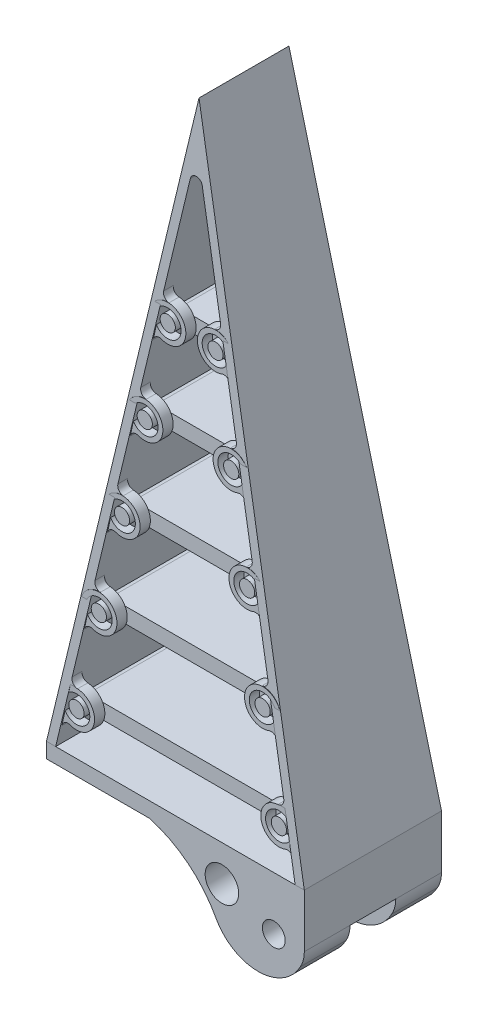
from build123d import *
from build123d.topology import SkipClean

# Parameters (mm, degrees)
AUFSATZ_LINEAR_AUSTRAGEN4_DEPTH      = 18
SCHNITT_LINEAR_AUSTRAGEN1_DEPTH      = 89.73537072
AUFSATZ_LINEAR_AUSTRAGEN5_DEPTH      = 5.37
AUFSATZ_LINEAR_AUSTRAGEN5_DEPTH_BACK = 5.37
AUFSATZ_LINEAR_AUSTRAGEN6_DEPTH      = 5.85
AUFSATZ_LINEAR_AUSTRAGEN6_DEPTH_BACK = 5.85
AUFSATZ_LINEAR_AUSTRAGEN7_DEPTH      = 6.3
AUFSATZ_LINEAR_AUSTRAGEN7_DEPTH_BACK = 6.3
AUFSATZ_LINEAR_AUSTRAGEN8_DEPTH      = 6.8
AUFSATZ_LINEAR_AUSTRAGEN8_DEPTH_BACK = 6.8
AUFSATZ_LINEAR_AUSTRAGEN9_DEPTH      = 7.2
AUFSATZ_LINEAR_AUSTRAGEN9_DEPTH_BACK = 7.2
SKIZZE13_R                           = 1
AUFSATZ_LINEAR_AUSTRAGEN12_DEPTH     = 1.5
SKIZZE15_R                           = 1
AUFSATZ_LINEAR_AUSTRAGEN14_DEPTH     = 1.5
SKIZZE14_R                           = 1
AUFSATZ_LINEAR_AUSTRAGEN13_DEPTH     = 1.5
SKIZZE16_R                           = 1
AUFSATZ_LINEAR_AUSTRAGEN15_DEPTH     = 1.5
SKIZZE17_R                           = 1
AUFSATZ_LINEAR_AUSTRAGEN16_DEPTH     = 1.5
SKIZZE18_R                           = 1
AUFSATZ_LINEAR_AUSTRAGEN17_DEPTH     = 1.5
SKIZZE19_R                           = 1
AUFSATZ_LINEAR_AUSTRAGEN18_DEPTH     = 1.5
SKIZZE20_R                           = 1
AUFSATZ_LINEAR_AUSTRAGEN19_DEPTH     = 1.5
SKIZZE21_R                           = 1
AUFSATZ_LINEAR_AUSTRAGEN20_DEPTH     = 1.5
SKIZZE22_R                           = 1
AUFSATZ_LINEAR_AUSTRAGEN21_DEPTH     = 1.5
SKIZZE24_R                           = 2.375
SKIZZE24_R_2                         = 1.75
AUFSATZ_LINEAR_AUSTRAGEN22_DEPTH     = 1.35
SKIZZE25_R                           = 2.375
SKIZZE25_R_2                         = 1.75
AUFSATZ_LINEAR_AUSTRAGEN23_DEPTH     = 1.35
SKIZZE26_R                           = 2.375
SKIZZE26_R_2                         = 1.75
AUFSATZ_LINEAR_AUSTRAGEN24_DEPTH     = 1.35
SKIZZE27_R                           = 2.375
SKIZZE27_R_2                         = 1.75
AUFSATZ_LINEAR_AUSTRAGEN25_DEPTH     = 1.35
SKIZZE28_R                           = 2.375
SKIZZE28_R_2                         = 1.75
AUFSATZ_LINEAR_AUSTRAGEN26_DEPTH     = 1.35
AUFSATZ_LINEAR_START                 = -1.35
SKIZZE29_R                           = 2.375
SKIZZE29_R_2                         = 1.75
AUFSATZ_LINEAR_AUSTRAGEN27_DEPTH     = 1.35
SKIZZE30_R                           = 2.375
SKIZZE30_R_2                         = 1.75
AUFSATZ_LINEAR_AUSTRAGEN28_DEPTH     = 1.35
SKIZZE31_R                           = 2.375
SKIZZE31_R_2                         = 1.75
AUFSATZ_LINEAR_AUSTRAGEN29_DEPTH     = 1.35
SKIZZE32_R                           = 2.375
SKIZZE32_R_2                         = 1.75
AUFSATZ_LINEAR_AUSTRAGEN30_DEPTH     = 1.35
SKIZZE33_R                           = 2.375
SKIZZE33_R_2                         = 1.75
AUFSATZ_LINEAR_AUSTRAGEN31_DEPTH     = 1.35
VERRUNDUNG1_R                        = 0.8
VERRUNDUNG2_R                        = 0.8
AUFSATZ_LINEAR_AUSTRAGEN32_DEPTH     = 2
SKIZZE38_R                           = 4
SKIZZE38_R_2                         = 1.5
AUFSATZ_LINEAR_AUSTRAGEN34_DEPTH     = 18
SCHNITT_LINEAR_START                 = -6
SKIZZE39_R                           = 4
SCHNITT_LINEAR_AUSTRAGEN2_DEPTH      = 6
SKIZZE40_W                           = 6
SKIZZE40_H                           = 11.711498973
SCHNITT_LINEAR_AUSTRAGEN3_DEPTH      = 33.6
SKIZZE41_R                           = 2.2
SCHNITT_LINEAR_AUSTRAGEN4_DEPTH      = 96.518560321
AUFSATZ_LINEAR_AUSTRAGEN35_DEPTH     = 25


with BuildPart() as part:
    # Skizze1 → Aufsatz-Linear austragen4 (new body)
    with BuildSketch(Plane.XY):
        Polygon((0, 0), (16.911148858, -80), (15.711148858, -80), (0, -5.676728459), (-15.711148858, -80), (-16.911148858, -80), align=None)
    extrude(amount=AUFSATZ_LINEAR_AUSTRAGEN4_DEPTH)

    # Skizze11 → Schnitt-Linear austragen1 (cut, through all)
    with BuildSketch(Plane(origin=(17, 0, 0), x_dir=(0, 0, -1), z_dir=(1, 0, 0))):
        Polygon((-18, -80), (-14.9, 0), (-18, 0), align=None)
        Polygon((0, -80), (-3.1, 0), (0, 0), align=None)
    extrude(amount=-SCHNITT_LINEAR_AUSTRAGEN1_DEPTH, mode=Mode.SUBTRACT)

    # Skizze24 → Aufsatz-Linear austragen22 (add)
    # profile 1 of 2: a face of its own
    with BuildSketch(Plane.XY.offset(15.87)):
        with Locations((-3.132547008, -26.676728459)):
            Circle(SKIZZE24_R)
        with Locations((-3.132547008, -26.676728459)):
            Circle(SKIZZE24_R_2, mode=Mode.SUBTRACT)
    # profile 2 of 2: a face of its own
    with BuildSketch(Plane.XY.offset(15.87)):
        with Locations((3.132547008, -26.676728459)):
            Circle(SKIZZE24_R)
        with Locations((3.132547008, -26.676728459)):
            Circle(SKIZZE24_R_2, mode=Mode.SUBTRACT)
    extrude(amount=-AUFSATZ_LINEAR_AUSTRAGEN22_DEPTH)

    # Skizze25 → Aufsatz-Linear austragen23 (add)
    # profile 1 of 2: a face of its own
    with BuildSketch(Plane.XY.offset(16.35)):
        with Locations((-5.669219336, -38.676728459)):
            Circle(SKIZZE25_R)
        with Locations((-5.669219336, -38.676728459)):
            Circle(SKIZZE25_R_2, mode=Mode.SUBTRACT)
    # profile 2 of 2: a face of its own
    with BuildSketch(Plane.XY.offset(16.35)):
        with Locations((5.669219336, -38.676728459)):
            Circle(SKIZZE25_R)
        with Locations((5.669219336, -38.676728459)):
            Circle(SKIZZE25_R_2, mode=Mode.SUBTRACT)
    extrude(amount=-AUFSATZ_LINEAR_AUSTRAGEN23_DEPTH)

    # Skizze26 → Aufsatz-Linear austragen24 (add)
    # profile 1 of 2: a face of its own
    with BuildSketch(Plane.XY.offset(16.8)):
        with Locations((-8.205891665, -50.676728459)):
            Circle(SKIZZE26_R)
        with Locations((-8.205891665, -50.676728459)):
            Circle(SKIZZE26_R_2, mode=Mode.SUBTRACT)
    # profile 2 of 2: a face of its own
    with BuildSketch(Plane.XY.offset(16.8)):
        with Locations((8.205891665, -50.676728459)):
            Circle(SKIZZE26_R)
        with Locations((8.205891665, -50.676728459)):
            Circle(SKIZZE26_R_2, mode=Mode.SUBTRACT)
    extrude(amount=-AUFSATZ_LINEAR_AUSTRAGEN24_DEPTH)

    # Skizze27 → Aufsatz-Linear austragen25 (add)
    # profile 1 of 2: a face of its own
    with BuildSketch(Plane.XY.offset(17.3)):
        with Locations((-10.742563994, -62.676728459)):
            Circle(SKIZZE27_R)
        with Locations((-10.742563994, -62.676728459)):
            Circle(SKIZZE27_R_2, mode=Mode.SUBTRACT)
    # profile 2 of 2: a face of its own
    with BuildSketch(Plane.XY.offset(17.3)):
        with Locations((10.742563994, -62.676728459)):
            Circle(SKIZZE27_R)
        with Locations((10.742563994, -62.676728459)):
            Circle(SKIZZE27_R_2, mode=Mode.SUBTRACT)
    extrude(amount=-AUFSATZ_LINEAR_AUSTRAGEN25_DEPTH)

    # Skizze28 → Aufsatz-Linear austragen26 (add)
    # profile 1 of 2: a face of its own
    with BuildSketch(Plane.XY.offset(17.7)):
        with Locations((-13.279236322, -74.676728459)):
            Circle(SKIZZE28_R)
        with Locations((-13.279236322, -74.676728459)):
            Circle(SKIZZE28_R_2, mode=Mode.SUBTRACT)
    # profile 2 of 2: a face of its own
    with BuildSketch(Plane.XY.offset(17.7)):
        with Locations((13.279236322, -74.676728459)):
            Circle(SKIZZE28_R)
        with Locations((13.279236322, -74.676728459)):
            Circle(SKIZZE28_R_2, mode=Mode.SUBTRACT)
    extrude(amount=-AUFSATZ_LINEAR_AUSTRAGEN26_DEPTH)

    # Skizze29 → Aufsatz-Linear austragen27 (add)
    # profile 1 of 2: a face of its own
    with BuildSketch(Plane(origin=(0, 0, 2.13), x_dir=(-1, 0, 0), z_dir=(0, 0, -1)).offset(AUFSATZ_LINEAR_START)):
        with Locations((-3.132547008, -26.676728459)):
            Circle(SKIZZE29_R)
        with Locations((-3.132547008, -26.676728459)):
            Circle(SKIZZE29_R_2, mode=Mode.SUBTRACT)
    # profile 2 of 2: a face of its own
    with BuildSketch(Plane(origin=(0, 0, 2.13), x_dir=(-1, 0, 0), z_dir=(0, 0, -1)).offset(AUFSATZ_LINEAR_START)):
        with Locations((3.132547008, -26.676728459)):
            Circle(SKIZZE29_R)
        with Locations((3.132547008, -26.676728459)):
            Circle(SKIZZE29_R_2, mode=Mode.SUBTRACT)
    extrude(amount=AUFSATZ_LINEAR_AUSTRAGEN27_DEPTH)

    # Skizze30 → Aufsatz-Linear austragen28 (add)
    # profile 1 of 2: a face of its own
    with BuildSketch(Plane(origin=(0, 0, 1.65), x_dir=(-1, 0, 0), z_dir=(0, 0, -1)).offset(AUFSATZ_LINEAR_START)):
        with Locations((-5.669219336, -38.676728459)):
            Circle(SKIZZE30_R)
        with Locations((-5.669219336, -38.676728459)):
            Circle(SKIZZE30_R_2, mode=Mode.SUBTRACT)
    # profile 2 of 2: a face of its own
    with BuildSketch(Plane(origin=(0, 0, 1.65), x_dir=(-1, 0, 0), z_dir=(0, 0, -1)).offset(AUFSATZ_LINEAR_START)):
        with Locations((5.669219336, -38.676728459)):
            Circle(SKIZZE30_R)
        with Locations((5.669219336, -38.676728459)):
            Circle(SKIZZE30_R_2, mode=Mode.SUBTRACT)
    extrude(amount=AUFSATZ_LINEAR_AUSTRAGEN28_DEPTH)

    # Skizze31 → Aufsatz-Linear austragen29 (add)
    # profile 1 of 2: a face of its own
    with BuildSketch(Plane(origin=(0, 0, 1.2), x_dir=(-1, 0, 0), z_dir=(0, 0, -1)).offset(AUFSATZ_LINEAR_START)):
        with Locations((-8.205891665, -50.676728459)):
            Circle(SKIZZE31_R)
        with Locations((-8.205891665, -50.676728459)):
            Circle(SKIZZE31_R_2, mode=Mode.SUBTRACT)
    # profile 2 of 2: a face of its own
    with BuildSketch(Plane(origin=(0, 0, 1.2), x_dir=(-1, 0, 0), z_dir=(0, 0, -1)).offset(AUFSATZ_LINEAR_START)):
        with Locations((8.205891665, -50.676728459)):
            Circle(SKIZZE31_R)
        with Locations((8.205891665, -50.676728459)):
            Circle(SKIZZE31_R_2, mode=Mode.SUBTRACT)
    extrude(amount=AUFSATZ_LINEAR_AUSTRAGEN29_DEPTH)

    # Skizze32 → Aufsatz-Linear austragen30 (add)
    # profile 1 of 2: a face of its own
    with BuildSketch(Plane(origin=(0, 0, 0.7), x_dir=(-1, 0, 0), z_dir=(0, 0, -1)).offset(AUFSATZ_LINEAR_START)):
        with Locations((-10.742563994, -62.676728459)):
            Circle(SKIZZE32_R)
        with Locations((-10.742563994, -62.676728459)):
            Circle(SKIZZE32_R_2, mode=Mode.SUBTRACT)
    # profile 2 of 2: a face of its own
    with BuildSketch(Plane(origin=(0, 0, 0.7), x_dir=(-1, 0, 0), z_dir=(0, 0, -1)).offset(AUFSATZ_LINEAR_START)):
        with Locations((10.742563994, -62.676728459)):
            Circle(SKIZZE32_R)
        with Locations((10.742563994, -62.676728459)):
            Circle(SKIZZE32_R_2, mode=Mode.SUBTRACT)
    extrude(amount=AUFSATZ_LINEAR_AUSTRAGEN30_DEPTH)

    # Skizze33 → Aufsatz-Linear austragen31 (add)
    # profile 1 of 2: a face of its own
    with BuildSketch(Plane(origin=(0, 0, 0.3), x_dir=(-1, 0, 0), z_dir=(0, 0, -1)).offset(AUFSATZ_LINEAR_START)):
        with Locations((-13.279236322, -74.676728459)):
            Circle(SKIZZE33_R)
        with Locations((-13.279236322, -74.676728459)):
            Circle(SKIZZE33_R_2, mode=Mode.SUBTRACT)
    # profile 2 of 2: a face of its own
    with BuildSketch(Plane(origin=(0, 0, 0.3), x_dir=(-1, 0, 0), z_dir=(0, 0, -1)).offset(AUFSATZ_LINEAR_START)):
        with Locations((13.279236322, -74.676728459)):
            Circle(SKIZZE33_R)
        with Locations((13.279236322, -74.676728459)):
            Circle(SKIZZE33_R_2, mode=Mode.SUBTRACT)
    extrude(amount=AUFSATZ_LINEAR_AUSTRAGEN31_DEPTH)

    # Verrundung1
    verrundung1_edges = [part.edges().sort_by_distance(p)[0] for p in [
        (0, -5.676728459, 9),
    ]]
    fillet(verrundung1_edges, radius=VERRUNDUNG1_R)

    # Verrundung2
    # the kernel refuses this fillet: 0.8 mm, written as the material it adds along each edge
    with BuildSketch(Plane(origin=(7.333926251, -40.370651683, 15), x_dir=(0.20681895998091462, -0.9783792300495819, 0), z_dir=(0, 0, 1)), Plane(origin=(9.87059858, -52.370651683, 15.45), x_dir=(0.20681895998091263, -0.9783792300495825, 0), z_dir=(0, 0, 1)), Plane(origin=(12.407270908, -64.370651683, 15.95), x_dir=(0.20681895998091412, -0.9783792300495822, 0), z_dir=(0, 0, 1)), Plane(origin=(14.943943237, -76.370651683, 16.35), x_dir=(0.20681895998090907, -0.9783792300495833, 0), z_dir=(0, 0, 1)), Plane(origin=(4.797253922, -28.370651683, 2.13), x_dir=(0.20681895998091462, -0.9783792300495819, 0), z_dir=(0, 0, 1)), Plane(origin=(7.333926251, -40.370651683, 1.65), x_dir=(0.20681895998091462, -0.9783792300495819, 0), z_dir=(0, 0, 1)), Plane(origin=(9.87059858, -52.370651683, 1.2), x_dir=(0.20681895998091412, -0.9783792300495822, 0), z_dir=(0, 0, 1)), Plane(origin=(12.407270908, -64.370651683, 0.7), x_dir=(0.20681895998091412, -0.9783792300495822, 0), z_dir=(0, 0, 1)), Plane(origin=(14.943943237, -76.370651683, 0.3), x_dir=(0.20681895998091113, -0.9783792300495827, 0), z_dir=(0, 0, 1)), Plane(origin=(4.797253922, -28.370651683, 14.52), x_dir=(0.20681895998091462, -0.9783792300495819, 0), z_dir=(0, 0, 1))) as verrundung2_piece_1:
        with BuildLine():
            CenterArc((1.137162009, -0.8), VERRUNDUNG2_R, 90, 98.665792169)
            ThreePointArc((0.346294794, -0.920536499), (0.221320117, -0.44214625), (0, 0))
            Line((0, 0), (1.137162009, 0))
        make_face()
    extrude(amount=1.35)
    with BuildSketch(Plane(origin=(6.505991795, -36.45401911, 15), x_dir=(-0.20681895998091487, 0.9783792300495819, 0), z_dir=(0, 0, 1))) as verrundung2_piece_2_section:
        with BuildLine():
            CenterArc((1.137162009, 0.8), VERRUNDUNG2_R, 171.334207831, 98.665792169)
            ThreePointArc((0.346294794, 0.920536499), (0.221320117, 0.44214625), (0, 0))
            Line((0, 0), (1.137162009, 0))
        make_face()
    verrundung2_piece_2 = extrude(amount=4.155498263, mode=Mode.PRIVATE)
    verrundung2_piece_2 = split(verrundung2_piece_2, bisect_by=Plane(origin=(6.217215771, -36.095589606, 16.298704097), z_dir=(0, -0.03872093994908253, -0.9992500632021294)), keep=Keep.TOP, mode=Mode.PRIVATE)
    add(verrundung2_piece_2)
    with BuildSketch(Plane(origin=(-9.87059858, -52.370651683, 15.45), x_dir=(-0.20681895998091412, -0.9783792300495822, 0), z_dir=(0, 0, 1)), Plane(origin=(-12.407270908, -64.370651683, 15.95), x_dir=(-0.2068189599809156, -0.9783792300495817, 0), z_dir=(0, 0, 1)), Plane(origin=(-14.943943237, -76.370651683, 16.35), x_dir=(-0.2068189599809131, -0.9783792300495824, 0), z_dir=(0, 0, 1)), Plane(origin=(-4.797253922, -28.370651683, 2.13), x_dir=(-0.20681895998091113, -0.9783792300495827, 0), z_dir=(0, 0, 1)), Plane(origin=(-7.333926251, -40.370651683, 1.65), x_dir=(-0.2068189599809139, -0.9783792300495822, 0), z_dir=(0, 0, 1)), Plane(origin=(-9.87059858, -52.370651683, 1.2), x_dir=(-0.20681895998091412, -0.9783792300495822, 0), z_dir=(0, 0, 1)), Plane(origin=(-12.407270908, -64.370651683, 0.7), x_dir=(-0.20681895998091412, -0.9783792300495822, 0), z_dir=(0, 0, 1)), Plane(origin=(-14.943943237, -76.370651683, 0.3), x_dir=(-0.2068189599809131, -0.9783792300495824, 0), z_dir=(0, 0, 1)), Plane(origin=(-4.797253922, -28.370651683, 14.52), x_dir=(-0.20681895998091177, -0.9783792300495826, 0), z_dir=(0, 0, 1)), Plane(origin=(-7.333926251, -40.370651683, 15), x_dir=(-0.20681895998091412, -0.9783792300495822, 0), z_dir=(0, 0, 1))) as verrundung2_piece_3:
        with BuildLine():
            CenterArc((1.137162009, 0.8), VERRUNDUNG2_R, 171.334207831, 98.665792169)
            ThreePointArc((0.346294794, 0.920536499), (0.221320117, 0.44214625), (0, 0))
            Line((0, 0), (1.137162009, 0))
        make_face()
    extrude(amount=1.35)
    with BuildSketch(Plane(origin=(-9.042664124, -48.45401911, 15.45), x_dir=(0.20681895998091288, 0.9783792300495825, 0), z_dir=(0, 0, 1))) as verrundung2_piece_4_section:
        with BuildLine():
            CenterArc((1.137162009, -0.8), VERRUNDUNG2_R, 90, 98.665792169)
            ThreePointArc((0.346294794, -0.920536499), (0.221320117, -0.44214625), (0, 0))
            Line((0, 0), (1.137162009, 0))
        make_face()
    verrundung2_piece_4 = extrude(amount=4.170498263, mode=Mode.PRIVATE)
    verrundung2_piece_4 = split(verrundung2_piece_4, bisect_by=Plane(origin=(-8.753891259, -48.095283689, 16.763692243), z_dir=(0, -0.03872093994908253, -0.9992500632021294)), keep=Keep.TOP, mode=Mode.PRIVATE)
    add(verrundung2_piece_4)
    with BuildSketch(Plane(origin=(9.042664124, -48.45401911, 15.45), x_dir=(-0.2068189599809156, 0.9783792300495817, 0), z_dir=(0, 0, 1))) as verrundung2_piece_5_section:
        with BuildLine():
            CenterArc((1.137162009, 0.8), VERRUNDUNG2_R, 171.334207831, 98.665792169)
            ThreePointArc((0.346294794, 0.920536499), (0.221320117, 0.44214625), (0, 0))
            Line((0, 0), (1.137162009, 0))
        make_face()
    verrundung2_piece_5 = extrude(amount=4.170498263, mode=Mode.PRIVATE)
    verrundung2_piece_5 = split(verrundung2_piece_5, bisect_by=Plane(origin=(8.753891259, -48.095283689, 16.763692243), z_dir=(0, -0.03872093994908253, -0.9992500632021294)), keep=Keep.TOP, mode=Mode.PRIVATE)
    add(verrundung2_piece_5)
    with BuildSketch(Plane(origin=(-11.579336453, -60.45401911, 15.95), x_dir=(0.2068189599809101, 0.9783792300495829, 0), z_dir=(0, 0, 1))) as verrundung2_piece_6_section:
        with BuildLine():
            CenterArc((1.137162009, -0.8), VERRUNDUNG2_R, 90, 98.665792169)
            ThreePointArc((0.346294794, -0.920536499), (0.221320117, -0.44214625), (0, 0))
            Line((0, 0), (1.137162009, 0))
        make_face()
    verrundung2_piece_6 = extrude(amount=4.135498263, mode=Mode.PRIVATE)
    verrundung2_piece_6 = split(verrundung2_piece_6, bisect_by=Plane(origin=(-11.290556099, -60.095998069, 17.228719925), z_dir=(0, -0.03872093994908253, -0.9992500632021294)), keep=Keep.TOP, mode=Mode.PRIVATE)
    add(verrundung2_piece_6)
    with BuildSketch(Plane(origin=(11.579336453, -60.45401911, 15.95), x_dir=(-0.20681895998091435, 0.978379230049582, 0), z_dir=(0, 0, 1))) as verrundung2_piece_7_section:
        with BuildLine():
            CenterArc((1.137162009, 0.8), VERRUNDUNG2_R, 171.334207831, 98.665792169)
            ThreePointArc((0.346294794, 0.920536499), (0.221320117, 0.44214625), (0, 0))
            Line((0, 0), (1.137162009, 0))
        make_face()
    verrundung2_piece_7 = extrude(amount=4.135498263, mode=Mode.PRIVATE)
    verrundung2_piece_7 = split(verrundung2_piece_7, bisect_by=Plane(origin=(11.290556099, -60.095998069, 17.228719925), z_dir=(0, -0.03872093994908253, -0.9992500632021294)), keep=Keep.TOP, mode=Mode.PRIVATE)
    add(verrundung2_piece_7)
    with BuildSketch(Plane(origin=(-14.116008781, -72.45401911, 16.35), x_dir=(0.20681895998091412, 0.9783792300495822, 0), z_dir=(0, 0, 1))) as verrundung2_piece_8_section:
        with BuildLine():
            CenterArc((1.137162009, -0.8), VERRUNDUNG2_R, 90, 98.665792169)
            ThreePointArc((0.346294794, -0.920536499), (0.221320117, -0.44214625), (0, 0))
            Line((0, 0), (1.137162009, 0))
        make_face()
    verrundung2_piece_8 = extrude(amount=1.35, mode=Mode.PRIVATE)
    verrundung2_piece_8 = split(verrundung2_piece_8, bisect_by=Plane(origin=(-13.827218085, -72.094512866, 17.693662374), z_dir=(0, -0.03872093994908253, -0.9992500632021294)), keep=Keep.TOP, mode=Mode.PRIVATE)
    add(verrundung2_piece_8)
    with BuildSketch(Plane(origin=(14.116008781, -72.45401911, 16.35), x_dir=(-0.20681895998091662, 0.9783792300495815, 0), z_dir=(0, 0, 1))) as verrundung2_piece_9_section:
        with BuildLine():
            CenterArc((1.137162009, 0.8), VERRUNDUNG2_R, 171.334207831, 98.665792169)
            ThreePointArc((0.346294794, 0.920536499), (0.221320117, 0.44214625), (0, 0))
            Line((0, 0), (1.137162009, 0))
        make_face()
    verrundung2_piece_9 = extrude(amount=1.35, mode=Mode.PRIVATE)
    verrundung2_piece_9 = split(verrundung2_piece_9, bisect_by=Plane(origin=(13.827218085, -72.094512866, 17.693662374), z_dir=(0, -0.03872093994908253, -0.9992500632021294)), keep=Keep.TOP, mode=Mode.PRIVATE)
    add(verrundung2_piece_9)
    with BuildSketch(Plane(origin=(3.969319467, -24.45401911, -0.690498263), x_dir=(-0.20681895998091412, 0.9783792300495822, 0), z_dir=(0, 0, 1))) as verrundung2_piece_10_section:
        with BuildLine():
            CenterArc((1.137162009, 0.8), VERRUNDUNG2_R, 171.334207831, 98.665792169)
            ThreePointArc((0.346294794, 0.920536499), (0.221320117, 0.44214625), (0, 0))
            Line((0, 0), (1.137162009, 0))
        make_face()
    verrundung2_piece_10 = extrude(amount=4.170498263, mode=Mode.PRIVATE)
    verrundung2_piece_10 = split(verrundung2_piece_10, bisect_by=Plane(origin=(3.680546602, -24.095283689, 2.166307757), z_dir=(0, -0.03872093994908251, 0.9992500632021294)), keep=Keep.TOP, mode=Mode.PRIVATE)
    add(verrundung2_piece_10)
    with BuildSketch(Plane(origin=(-3.969319467, -24.45401911, -0.690498263), x_dir=(0.20681895998091285, 0.9783792300495823, 0), z_dir=(0, 0, 1))) as verrundung2_piece_11_section:
        with BuildLine():
            CenterArc((1.137162009, -0.8), VERRUNDUNG2_R, 90, 98.665792169)
            ThreePointArc((0.346294794, -0.920536499), (0.221320117, -0.44214625), (0, 0))
            Line((0, 0), (1.137162009, 0))
        make_face()
    verrundung2_piece_11 = extrude(amount=4.170498263, mode=Mode.PRIVATE)
    verrundung2_piece_11 = split(verrundung2_piece_11, bisect_by=Plane(origin=(-3.680546602, -24.095283689, 2.166307757), z_dir=(0, -0.03872093994908251, 0.9992500632021294)), keep=Keep.TOP, mode=Mode.PRIVATE)
    add(verrundung2_piece_11)
    with BuildSketch(Plane(origin=(6.505991795, -36.45401911, -1.155498263), x_dir=(-0.20681895998091537, 0.9783792300495818, 0), z_dir=(0, 0, 1))) as verrundung2_piece_12_section:
        with BuildLine():
            CenterArc((1.137162009, 0.8), VERRUNDUNG2_R, 171.334207831, 98.665792169)
            ThreePointArc((0.346294794, 0.920536499), (0.221320117, 0.44214625), (0, 0))
            Line((0, 0), (1.137162009, 0))
        make_face()
    verrundung2_piece_12 = extrude(amount=4.155498263, mode=Mode.PRIVATE)
    verrundung2_piece_12 = split(verrundung2_piece_12, bisect_by=Plane(origin=(6.217215771, -36.095589606, 1.701295903), z_dir=(0, -0.03872093994908251, 0.9992500632021294)), keep=Keep.TOP, mode=Mode.PRIVATE)
    add(verrundung2_piece_12)
    with BuildSketch(Plane(origin=(-6.505991795, -36.45401911, -1.155498263), x_dir=(0.20681895998091288, 0.9783792300495825, 0), z_dir=(0, 0, 1))) as verrundung2_piece_13_section:
        with BuildLine():
            CenterArc((1.137162009, -0.8), VERRUNDUNG2_R, 90, 98.665792169)
            ThreePointArc((0.346294794, -0.920536499), (0.221320117, -0.44214625), (0, 0))
            Line((0, 0), (1.137162009, 0))
        make_face()
    verrundung2_piece_13 = extrude(amount=4.155498263, mode=Mode.PRIVATE)
    verrundung2_piece_13 = split(verrundung2_piece_13, bisect_by=Plane(origin=(-6.217215771, -36.095589606, 1.701295903), z_dir=(0, -0.03872093994908251, 0.9992500632021294)), keep=Keep.TOP, mode=Mode.PRIVATE)
    add(verrundung2_piece_13)
    with BuildSketch(Plane(origin=(9.042664124, -48.45401911, -1.620498263), x_dir=(-0.20681895998091412, 0.9783792300495822, 0), z_dir=(0, 0, 1))) as verrundung2_piece_14_section:
        with BuildLine():
            CenterArc((1.137162009, 0.8), VERRUNDUNG2_R, 171.334207831, 98.665792169)
            ThreePointArc((0.346294794, 0.920536499), (0.221320117, 0.44214625), (0, 0))
            Line((0, 0), (1.137162009, 0))
        make_face()
    verrundung2_piece_14 = extrude(amount=4.170498263, mode=Mode.PRIVATE)
    verrundung2_piece_14 = split(verrundung2_piece_14, bisect_by=Plane(origin=(8.753891259, -48.095283689, 1.236307757), z_dir=(0, -0.03872093994908251, 0.9992500632021294)), keep=Keep.TOP, mode=Mode.PRIVATE)
    add(verrundung2_piece_14)
    with BuildSketch(Plane(origin=(-9.042664124, -48.45401911, -1.620498263), x_dir=(0.20681895998091263, 0.9783792300495825, 0), z_dir=(0, 0, 1))) as verrundung2_piece_15_section:
        with BuildLine():
            CenterArc((1.137162009, -0.8), VERRUNDUNG2_R, 90, 98.665792169)
            ThreePointArc((0.346294794, -0.920536499), (0.221320117, -0.44214625), (0, 0))
            Line((0, 0), (1.137162009, 0))
        make_face()
    verrundung2_piece_15 = extrude(amount=4.170498263, mode=Mode.PRIVATE)
    verrundung2_piece_15 = split(verrundung2_piece_15, bisect_by=Plane(origin=(-8.753891259, -48.095283689, 1.236307757), z_dir=(0, -0.03872093994908251, 0.9992500632021294)), keep=Keep.TOP, mode=Mode.PRIVATE)
    add(verrundung2_piece_15)
    with BuildSketch(Plane(origin=(11.579336453, -60.45401911, -2.085498263), x_dir=(-0.20681895998091412, 0.9783792300495822, 0), z_dir=(0, 0, 1))) as verrundung2_piece_16_section:
        with BuildLine():
            CenterArc((1.137162009, 0.8), VERRUNDUNG2_R, 171.334207831, 98.665792169)
            ThreePointArc((0.346294794, 0.920536499), (0.221320117, 0.44214625), (0, 0))
            Line((0, 0), (1.137162009, 0))
        make_face()
    verrundung2_piece_16 = extrude(amount=4.135498263, mode=Mode.PRIVATE)
    verrundung2_piece_16 = split(verrundung2_piece_16, bisect_by=Plane(origin=(11.290556099, -60.095998069, 0.771280075), z_dir=(0, -0.03872093994908251, 0.9992500632021294)), keep=Keep.TOP, mode=Mode.PRIVATE)
    add(verrundung2_piece_16)
    with BuildSketch(Plane(origin=(-11.579336453, -60.45401911, -2.085498263), x_dir=(0.2068189599809131, 0.9783792300495824, 0), z_dir=(0, 0, 1))) as verrundung2_piece_17_section:
        with BuildLine():
            CenterArc((1.137162009, -0.8), VERRUNDUNG2_R, 90, 98.665792169)
            ThreePointArc((0.346294794, -0.920536499), (0.221320117, -0.44214625), (0, 0))
            Line((0, 0), (1.137162009, 0))
        make_face()
    verrundung2_piece_17 = extrude(amount=4.135498263, mode=Mode.PRIVATE)
    verrundung2_piece_17 = split(verrundung2_piece_17, bisect_by=Plane(origin=(-11.290556099, -60.095998069, 0.771280075), z_dir=(0, -0.03872093994908251, 0.9992500632021294)), keep=Keep.TOP, mode=Mode.PRIVATE)
    add(verrundung2_piece_17)
    with BuildSketch(Plane(origin=(14.116008781, -72.45401911, 0.3), x_dir=(-0.2068189599809156, 0.9783792300495817, 0), z_dir=(0, 0, 1))) as verrundung2_piece_18_section:
        with BuildLine():
            CenterArc((1.137162009, 0.8), VERRUNDUNG2_R, 171.334207831, 98.665792169)
            ThreePointArc((0.346294794, 0.920536499), (0.221320117, 0.44214625), (0, 0))
            Line((0, 0), (1.137162009, 0))
        make_face()
    verrundung2_piece_18 = extrude(amount=1.35, mode=Mode.PRIVATE)
    verrundung2_piece_18 = split(verrundung2_piece_18, bisect_by=Plane(origin=(13.827218085, -72.094512866, 0.306337626), z_dir=(0, -0.03872093994908251, 0.9992500632021294)), keep=Keep.TOP, mode=Mode.PRIVATE)
    add(verrundung2_piece_18)
    with BuildSketch(Plane(origin=(-14.116008781, -72.45401911, 0.3), x_dir=(0.20681895998091412, 0.9783792300495822, 0), z_dir=(0, 0, 1))) as verrundung2_piece_19_section:
        with BuildLine():
            CenterArc((1.137162009, -0.8), VERRUNDUNG2_R, 90, 98.665792169)
            ThreePointArc((0.346294794, -0.920536499), (0.221320117, -0.44214625), (0, 0))
            Line((0, 0), (1.137162009, 0))
        make_face()
    verrundung2_piece_19 = extrude(amount=1.35, mode=Mode.PRIVATE)
    verrundung2_piece_19 = split(verrundung2_piece_19, bisect_by=Plane(origin=(-13.827218085, -72.094512866, 0.306337626), z_dir=(0, -0.03872093994908251, 0.9992500632021294)), keep=Keep.TOP, mode=Mode.PRIVATE)
    add(verrundung2_piece_19)
    with BuildSketch(Plane(origin=(-3.969319467, -24.45401911, 14.52), x_dir=(0.20681895998091399, 0.978379230049582, 0), z_dir=(0, 0, 1))) as verrundung2_piece_20_section:
        with BuildLine():
            CenterArc((1.137162009, -0.8), VERRUNDUNG2_R, 90, 98.665792169)
            ThreePointArc((0.346294794, -0.920536499), (0.221320117, -0.44214625), (0, 0))
            Line((0, 0), (1.137162009, 0))
        make_face()
    verrundung2_piece_20 = extrude(amount=4.170498263, mode=Mode.PRIVATE)
    verrundung2_piece_20 = split(verrundung2_piece_20, bisect_by=Plane(origin=(-3.680546602, -24.095283689, 15.833692243), z_dir=(0, -0.03872093994908253, -0.9992500632021294)), keep=Keep.TOP, mode=Mode.PRIVATE)
    add(verrundung2_piece_20)
    with BuildSketch(Plane(origin=(3.969319467, -24.45401911, 14.52), x_dir=(-0.20681895998091487, 0.9783792300495819, 0), z_dir=(0, 0, 1))) as verrundung2_piece_21_section:
        with BuildLine():
            CenterArc((1.137162009, 0.8), VERRUNDUNG2_R, 171.334207831, 98.665792169)
            ThreePointArc((0.346294794, 0.920536499), (0.221320117, 0.44214625), (0, 0))
            Line((0, 0), (1.137162009, 0))
        make_face()
    verrundung2_piece_21 = extrude(amount=4.170498263, mode=Mode.PRIVATE)
    verrundung2_piece_21 = split(verrundung2_piece_21, bisect_by=Plane(origin=(3.680546602, -24.095283689, 15.833692243), z_dir=(0, -0.03872093994908253, -0.9992500632021294)), keep=Keep.TOP, mode=Mode.PRIVATE)
    add(verrundung2_piece_21)
    with BuildSketch(Plane(origin=(-6.505991795, -36.45401911, 15), x_dir=(0.20681895998091263, 0.9783792300495825, 0), z_dir=(0, 0, 1))) as verrundung2_piece_22_section:
        with BuildLine():
            CenterArc((1.137162009, -0.8), VERRUNDUNG2_R, 90, 98.665792169)
            ThreePointArc((0.346294794, -0.920536499), (0.221320117, -0.44214625), (0, 0))
            Line((0, 0), (1.137162009, 0))
        make_face()
    verrundung2_piece_22 = extrude(amount=4.155498263, mode=Mode.PRIVATE)
    verrundung2_piece_22 = split(verrundung2_piece_22, bisect_by=Plane(origin=(-6.217215771, -36.095589606, 16.298704097), z_dir=(0, -0.03872093994908253, -0.9992500632021294)), keep=Keep.TOP, mode=Mode.PRIVATE)
    add(verrundung2_piece_22)

    # Skizze37 → Aufsatz-Linear austragen32 (add)
    with BuildSketch(Plane.XZ.offset(80)):
        Polygon((-16.911148858, 0), (-15.711148858, 0), (16.911148858, 0), (16.911148858, 18), (-16.911148858, 18), align=None)
    extrude(amount=AUFSATZ_LINEAR_AUSTRAGEN32_DEPTH)

    # Skizze38 → Aufsatz-Linear austragen34 (add)
    # profile 1 of 2: a face of its own
    with BuildSketch(Plane.XY.offset(18)):
        with BuildLine():
            Line((16.911148858, -87), (16.911148858, -82))
            Line((16.911148858, -82), (6.731290959, -82))
            Line((6.731290959, -82), (-3.39492553, -82))
            ThreePointArc((-3.39492553, -82), (1.666778025, -84.598508213), (5.313446098, -88.965990299))
            ThreePointArc((5.313446098, -88.965990299), (10.854055364, -92.270300803), (16.394664631, -88.965990299))
            ThreePointArc((16.394664631, -88.965990299), (9.042424062, -85.983649444), (16.911148858, -87))
        make_face()
    # profile 2 of 2: a face of its own
    with BuildSketch(Plane.XY.offset(18)):
        with Locations((12.911148858, -87)):
            Circle(SKIZZE38_R)
        with Locations((12.911148858, -87)):
            Circle(SKIZZE38_R_2, mode=Mode.SUBTRACT)
    extrude(amount=-AUFSATZ_LINEAR_AUSTRAGEN34_DEPTH)

    # Skizze39 → Schnitt-Linear austragen2 (cut)
    with BuildSketch(Plane.XY.offset(18).offset(SCHNITT_LINEAR_START)):
        with Locations((12.911148858, -87)):
            Circle(SKIZZE39_R)
    extrude(amount=-SCHNITT_LINEAR_AUSTRAGEN2_DEPTH, mode=Mode.SUBTRACT)

    # Skizze40 → Schnitt-Linear austragen3 (cut)
    with BuildSketch(Plane.ZY.offset(16.911148858)):
        with Locations((9, -87.855749487)):
            Rectangle(SKIZZE40_W, SKIZZE40_H)
    extrude(amount=-SCHNITT_LINEAR_AUSTRAGEN3_DEPTH, mode=Mode.SUBTRACT)

    # Skizze41 → Schnitt-Linear austragen4 (cut, through all)
    with BuildSketch(Plane(origin=(0, 0, 0), x_dir=(-1, 0, 0), z_dir=(0, 0, -1))):
        with Locations((-6.10507447, -84.7)):
            Circle(SKIZZE41_R)
    extrude(amount=-SCHNITT_LINEAR_AUSTRAGEN4_DEPTH, mode=Mode.SUBTRACT)

    # Skizze42 → Aufsatz-Linear austragen35 (add)
    with BuildSketch(Plane.ZY.offset(16.911148858)):
        with BuildLine():
            Line((8, -82), (9, -82))
            Line((9, -82), (9, -82.525307867))
            Line((9, -82.525307867), (8.82, -82.525307867))
            ThreePointArc((8.82, -82.525307867), (8.738401651, -82.277594904), (8.5, -82.171837374))
            ThreePointArc((8.5, -82.171837374), (8.261598349, -82.277594904), (8.18, -82.525307867))
            Line((8.18, -82.525307867), (8, -82.525307867))
            Line((8, -82.525307867), (8, -82))
        make_face()
    extrude(amount=-AUFSATZ_LINEAR_AUSTRAGEN35_DEPTH)


with BuildPart() as body_2:
    # Skizze6 → Aufsatz-Linear austragen5 (new, two sides: drawn at the far end of the back side and taken through both)
    with BuildSketch(Plane.XY.offset(9).offset(-AUFSATZ_LINEAR_AUSTRAGEN5_DEPTH_BACK)):
        with BuildLine():
            Line((3.132547008, -25.676728459), (-3.132547008, -25.676728459))
            ThreePointArc((-3.132547008, -25.676728459), (-4.132547008, -26.676728459), (-3.132547008, -27.676728459))
            Line((-3.132547008, -27.676728459), (3.132547008, -27.676728459))
            ThreePointArc((3.132547008, -27.676728459), (4.132547008, -26.676728459), (3.132547008, -25.676728459))
        make_face()
    extrude(amount=AUFSATZ_LINEAR_AUSTRAGEN5_DEPTH + AUFSATZ_LINEAR_AUSTRAGEN5_DEPTH_BACK)

    # Skizze13 → Aufsatz-Linear austragen12 (add)
    with BuildSketch(Plane.XY.offset(14.37)):
        with Locations((-3.132547008, -26.676728459)):
            Circle(SKIZZE13_R)
        with Locations((3.132547008, -26.676728459)):
            Circle(SKIZZE13_R)
    extrude(amount=AUFSATZ_LINEAR_AUSTRAGEN12_DEPTH)

    # Skizze18 → Aufsatz-Linear austragen17 (add)
    with SkipClean():  # the faces are left unmerged after this step: merging them gives an invalid solid
        with BuildSketch(Plane(origin=(0, 0, 3.63), x_dir=(-1, 0, 0), z_dir=(0, 0, -1))):
            with Locations(Location((-3.132547008, -26.676728459, 0), (0, 0, 180))):
                Circle(SKIZZE18_R)
            with Locations(Location((3.132547008, -26.676728459, 0), (0, 0, 180))):
                Circle(SKIZZE18_R)
        extrude(amount=AUFSATZ_LINEAR_AUSTRAGEN17_DEPTH)


with BuildPart() as body_3:
    # Skizze7 → Aufsatz-Linear austragen6 (new, two sides: drawn at the far end of the back side and taken through both)
    with BuildSketch(Plane.XY.offset(9).offset(-AUFSATZ_LINEAR_AUSTRAGEN6_DEPTH_BACK)):
        with BuildLine():
            Line((5.669219336, -37.676728459), (-5.669219336, -37.676728459))
            ThreePointArc((-5.669219336, -37.676728459), (-6.669219336, -38.676728459), (-5.669219336, -39.676728459))
            Line((-5.669219336, -39.676728459), (5.669219336, -39.676728459))
            ThreePointArc((5.669219336, -39.676728459), (6.669219336, -38.676728459), (5.669219336, -37.676728459))
        make_face()
    extrude(amount=AUFSATZ_LINEAR_AUSTRAGEN6_DEPTH + AUFSATZ_LINEAR_AUSTRAGEN6_DEPTH_BACK)

    # Skizze14 → Aufsatz-Linear austragen13 (add)
    with BuildSketch(Plane.XY.offset(14.85)):
        with Locations((-5.669219336, -38.676728459)):
            Circle(SKIZZE14_R)
        with Locations((5.669219336, -38.676728459)):
            Circle(SKIZZE14_R)
    extrude(amount=AUFSATZ_LINEAR_AUSTRAGEN13_DEPTH)

    # Skizze19 → Aufsatz-Linear austragen18 (add)
    with SkipClean():  # the faces are left unmerged after this step: merging them gives an invalid solid
        with BuildSketch(Plane(origin=(0, 0, 3.15), x_dir=(-1, 0, 0), z_dir=(0, 0, -1))):
            with Locations(Location((-5.669219336, -38.676728459, 0), (0, 0, 180))):
                Circle(SKIZZE19_R)
            with Locations(Location((5.669219336, -38.676728459, 0), (0, 0, 180))):
                Circle(SKIZZE19_R)
        extrude(amount=AUFSATZ_LINEAR_AUSTRAGEN18_DEPTH)


with BuildPart() as body_4:
    # Skizze8 → Aufsatz-Linear austragen7 (new, two sides: drawn at the far end of the back side and taken through both)
    with BuildSketch(Plane.XY.offset(9).offset(-AUFSATZ_LINEAR_AUSTRAGEN7_DEPTH_BACK)):
        with BuildLine():
            Line((8.205891665, -49.676728459), (-8.205891665, -49.676728459))
            ThreePointArc((-8.205891665, -49.676728459), (-9.205891665, -50.676728459), (-8.205891665, -51.676728459))
            Line((-8.205891665, -51.676728459), (8.205891665, -51.676728459))
            ThreePointArc((8.205891665, -51.676728459), (9.205891665, -50.676728459), (8.205891665, -49.676728459))
        make_face()
    extrude(amount=AUFSATZ_LINEAR_AUSTRAGEN7_DEPTH + AUFSATZ_LINEAR_AUSTRAGEN7_DEPTH_BACK)

    # Skizze15 → Aufsatz-Linear austragen14 (add)
    with BuildSketch(Plane.XY.offset(15.3)):
        with Locations((-8.205891665, -50.676728459)):
            Circle(SKIZZE15_R)
        with Locations((8.205891665, -50.676728459)):
            Circle(SKIZZE15_R)
    extrude(amount=AUFSATZ_LINEAR_AUSTRAGEN14_DEPTH)

    # Skizze20 → Aufsatz-Linear austragen19 (add)
    with BuildSketch(Plane(origin=(0, 0, 2.7), x_dir=(-1, 0, 0), z_dir=(0, 0, -1))):
        with Locations(Location((-8.205891665, -50.676728459, 0), (0, 0, 180))):
            Circle(SKIZZE20_R)
        with Locations(Location((8.205891665, -50.676728459, 0), (0, 0, 180))):
            Circle(SKIZZE20_R)
    extrude(amount=AUFSATZ_LINEAR_AUSTRAGEN19_DEPTH)


with BuildPart() as body_5:
    # Skizze9 → Aufsatz-Linear austragen8 (new, two sides: drawn at the far end of the back side and taken through both)
    with BuildSketch(Plane.XY.offset(9).offset(-AUFSATZ_LINEAR_AUSTRAGEN8_DEPTH_BACK)):
        with BuildLine():
            Line((10.742563994, -61.676728459), (-10.742563994, -61.676728459))
            ThreePointArc((-10.742563994, -61.676728459), (-11.742563994, -62.676728459), (-10.742563994, -63.676728459))
            Line((-10.742563994, -63.676728459), (10.742563994, -63.676728459))
            ThreePointArc((10.742563994, -63.676728459), (11.742563994, -62.676728459), (10.742563994, -61.676728459))
        make_face()
    extrude(amount=AUFSATZ_LINEAR_AUSTRAGEN8_DEPTH + AUFSATZ_LINEAR_AUSTRAGEN8_DEPTH_BACK)

    # Skizze16 → Aufsatz-Linear austragen15 (add)
    with BuildSketch(Plane.XY.offset(15.8)):
        with Locations((-10.742563994, -62.676728459)):
            Circle(SKIZZE16_R)
        with Locations((10.742563994, -62.676728459)):
            Circle(SKIZZE16_R)
    extrude(amount=AUFSATZ_LINEAR_AUSTRAGEN15_DEPTH)

    # Skizze21 → Aufsatz-Linear austragen20 (add)
    with BuildSketch(Plane(origin=(0, 0, 2.2), x_dir=(-1, 0, 0), z_dir=(0, 0, -1))):
        with Locations(Location((-10.742563994, -62.676728459, 0), (0, 0, 180))):
            Circle(SKIZZE21_R)
        with Locations(Location((10.742563994, -62.676728459, 0), (0, 0, 180))):
            Circle(SKIZZE21_R)
    extrude(amount=AUFSATZ_LINEAR_AUSTRAGEN20_DEPTH)


with BuildPart() as body_6:
    # Skizze10 → Aufsatz-Linear austragen9 (new, two sides: drawn at the far end of the back side and taken through both)
    with BuildSketch(Plane.XY.offset(9).offset(-AUFSATZ_LINEAR_AUSTRAGEN9_DEPTH_BACK)):
        with BuildLine():
            Line((13.279236322, -73.676728459), (-13.279236322, -73.676728459))
            ThreePointArc((-13.279236322, -73.676728459), (-14.279236322, -74.676728459), (-13.279236322, -75.676728459))
            Line((-13.279236322, -75.676728459), (13.279236322, -75.676728459))
            ThreePointArc((13.279236322, -75.676728459), (14.279236322, -74.676728459), (13.279236322, -73.676728459))
        make_face()
    extrude(amount=AUFSATZ_LINEAR_AUSTRAGEN9_DEPTH + AUFSATZ_LINEAR_AUSTRAGEN9_DEPTH_BACK)

    # Skizze17 → Aufsatz-Linear austragen16 (add)
    with BuildSketch(Plane.XY.offset(16.2)):
        with Locations((-13.279236322, -74.676728459)):
            Circle(SKIZZE17_R)
        with Locations((13.279236322, -74.676728459)):
            Circle(SKIZZE17_R)
    extrude(amount=AUFSATZ_LINEAR_AUSTRAGEN16_DEPTH)

    # Skizze22 → Aufsatz-Linear austragen21 (add)
    with SkipClean():  # the faces are left unmerged after this step: merging them gives an invalid solid
        with BuildSketch(Plane(origin=(0, 0, 1.8), x_dir=(-1, 0, 0), z_dir=(0, 0, -1))):
            with Locations(Location((-13.279236322, -74.676728459, 0), (0, 0, 180))):
                Circle(SKIZZE22_R)
            with Locations(Location((13.279236322, -74.676728459, 0), (0, 0, 180))):
                Circle(SKIZZE22_R)
        extrude(amount=AUFSATZ_LINEAR_AUSTRAGEN21_DEPTH)


solid = Compound([part.part, body_2.part, body_3.part, body_4.part, body_5.part, body_6.part])
